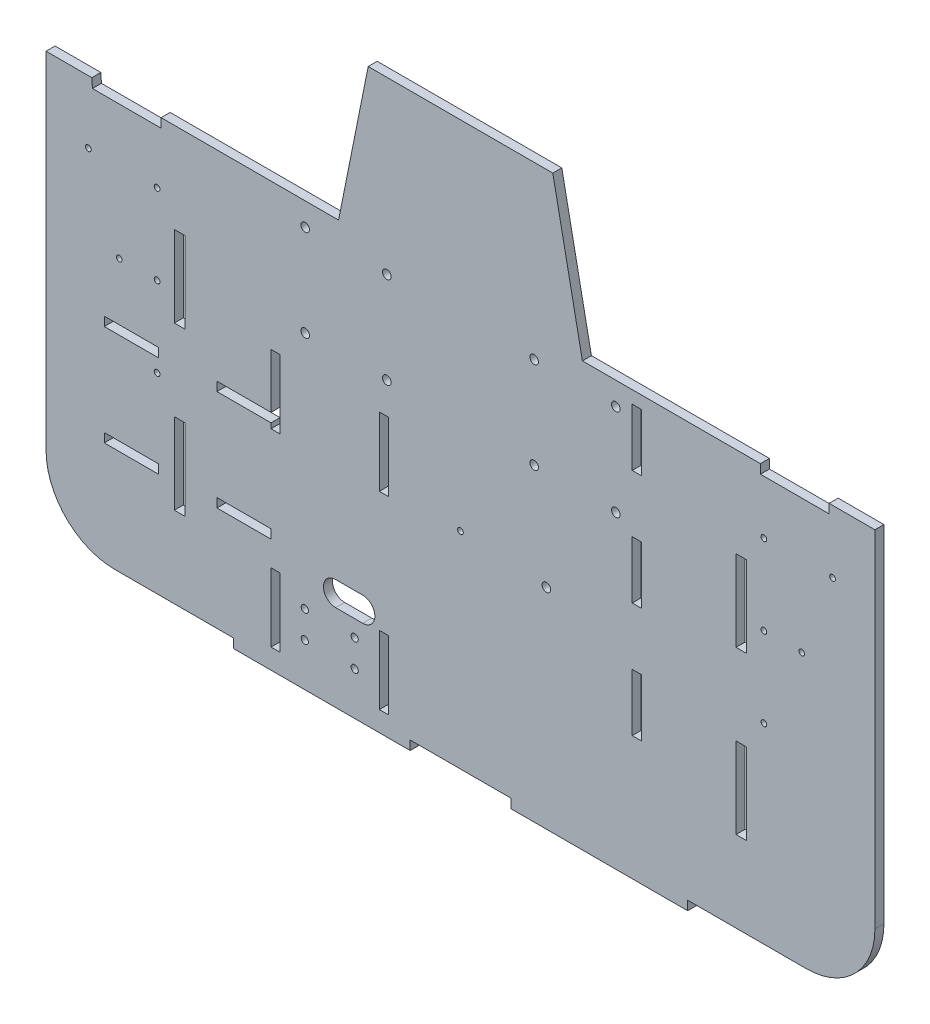
from build123d import *

# Parameters (mm, degrees)
SKETCH2_R           = 3.175
SKETCH2_R_2         = 4.7625
SKETCH2_R_3         = 4
SKETCH2_W           = 11.850089675
SKETCH2_H           = 89.916
SKETCH2_W_2         = 60
SKETCH2_H_2         = 10
SKETCH2_W_3         = 10.16
SKETCH2_H_3         = 63.685061478
SKETCH2_H_4         = 63.685061479
SKETCH2_H_5         = 76.2
BOSS_EXTRUDE1_DEPTH = 10


with BuildPart() as part:
    # Sketch2 → Boss-Extrude1 (new body)
    with BuildSketch(Plane.XY):
        with BuildLine():
            Line((-408.921789204, 152.75736057), (-459.721789204, 152.75736057))
            Line((-459.721789204, 152.75736057), (-459.721789204, -230.782639429))
            ThreePointArc((-459.721789204, -230.782639429), (-437.403325931, -284.664176156), (-383.521789204, -306.982639429))
            Line((-383.521789204, -306.982639429), (-303.52, -306.982639429))
            Line((-303.52, -306.982639429), (-252, -306.982639429))
            Line((-252, -306.982639429), (-252, -317.142639429))
            Line((-252, -317.142639429), (-55.8292, -317.142639429))
            Line((-55.8292, -317.142639429), (-55.8292, -306.982639429))
            Line((-55.8292, -306.982639429), (55.8292, -306.982639429))
            Line((55.8292, -306.982639429), (55.8292, -317.142639429))
            Line((55.8292, -317.142639429), (252, -317.142639429))
            Line((252, -317.142639429), (252, -306.982639429))
            Line((252, -306.982639429), (303.52, -306.982639429))
            Line((303.52, -306.982639429), (383.521789204, -306.982639429))
            ThreePointArc((383.521789204, -306.982639429), (437.403325931, -284.664176156), (459.721789204, -230.782639429))
            Line((459.721789204, -230.782639429), (459.721789204, 152.75736057))
            Line((459.721789204, 152.75736057), (408.921789204, 152.75736057))
            Line((408.921789204, 152.75736057), (408.921789204, 142.616356263))
            Line((408.921789204, 142.616356263), (332.721789204, 142.616356263))
            Line((332.721789204, 142.616356263), (332.721789204, 152.75736057))
            Line((332.721789204, 152.75736057), (135.250547773, 152.75736057))
            Line((135.250547773, 152.75736057), (102.394461083, 316.728644457))
            Line((102.394461083, 316.728644457), (-102.394461083, 316.728644457))
            Line((-102.394461083, 316.728644457), (-135.250547773, 152.75736057))
            Line((-135.250547773, 152.75736057), (-332.100796745, 152.75736057))
            Line((-332.100796745, 152.75736057), (-332.100796745, 142.616356263))
            Line((-332.100796745, 142.616356263), (-408.300796745, 142.616356263))
            Line((-408.300796745, 142.616356263), (-408.921789204, 152.75736057))
        make_face()
        with Locations((336.550272189, -94.687385458)):
            Circle(SKETCH2_R, mode=Mode.SUBTRACT)
        with Locations((378.573819589, -5.78737531)):
            Circle(SKETCH2_R, mode=Mode.SUBTRACT)
        with Locations((336.550272189, -5.787385458)):
            Circle(SKETCH2_R, mode=Mode.SUBTRACT)
        with Locations((336.550272189, 83.112614542)):
            Circle(SKETCH2_R, mode=Mode.SUBTRACT)
        with Locations((412.750272189, 83.112614542)):
            Circle(SKETCH2_R, mode=Mode.SUBTRACT)
        with Locations((-412.75027219, 83.112614542)):
            Circle(SKETCH2_R, mode=Mode.SUBTRACT)
        with Locations((-336.55027219, 83.112614542)):
            Circle(SKETCH2_R, mode=Mode.SUBTRACT)
        with Locations((-336.55027219, -5.787385458)):
            Circle(SKETCH2_R, mode=Mode.SUBTRACT)
        with Locations((-378.573819589, -5.78737531)):
            Circle(SKETCH2_R, mode=Mode.SUBTRACT)
        with Locations((-336.55027219, -94.687385458)):
            Circle(SKETCH2_R, mode=Mode.SUBTRACT)
        with Locations((172.2755, 127.35736057)):
            Circle(SKETCH2_R_2, mode=Mode.SUBTRACT)
        with Locations((172.2755, 25.75736057)):
            Circle(SKETCH2_R_2, mode=Mode.SUBTRACT)
        with Locations((81.7245, 25.75736057)):
            Circle(SKETCH2_R_2, mode=Mode.SUBTRACT)
        with Locations((81.7245, 127.35736057)):
            Circle(SKETCH2_R_2, mode=Mode.SUBTRACT)
        with Locations((-81.7245, 25.75736057)):
            Circle(SKETCH2_R_2, mode=Mode.SUBTRACT)
        with Locations((-81.7245, 127.35736057)):
            Circle(SKETCH2_R_2, mode=Mode.SUBTRACT)
        with Locations((-172.2755, 127.35736057)):
            Circle(SKETCH2_R_2, mode=Mode.SUBTRACT)
        with Locations((-172.2755, 25.75736057)):
            Circle(SKETCH2_R_2, mode=Mode.SUBTRACT)
        with Locations((0, -78.38263943)):
            Circle(SKETCH2_R, mode=Mode.SUBTRACT)
        with Locations((95.25, -84.73263943)):
            Circle(SKETCH2_R_2, mode=Mode.SUBTRACT)
        with Locations((-172.69, -239.442639429)):
            Circle(SKETCH2_R_3, mode=Mode.SUBTRACT)
        with Locations((-117.38, -239.442639429)):
            Circle(SKETCH2_R_3, mode=Mode.SUBTRACT)
        with Locations((-117.38, -269.442639429)):
            Circle(SKETCH2_R_3, mode=Mode.SUBTRACT)
        with Locations((-172.69, -269.442639429)):
            Circle(SKETCH2_R_3, mode=Mode.SUBTRACT)
        with Locations((311.557332494, 7.72336057)):
            Rectangle(SKETCH2_W, SKETCH2_H, mode=Mode.SUBTRACT)
        with Locations((311.557332494, -172.10863943)):
            Rectangle(SKETCH2_W, SKETCH2_H, mode=Mode.SUBTRACT)
        with Locations((-365.16, -74.446988355)):
            Rectangle(SKETCH2_W_2, SKETCH2_H_2, mode=Mode.SUBTRACT)
        Polygon((-270.16, -79.446988355), (-210.16, -79.446988355), (-210.16, -85.16237531), (-200, -85.16237531), (-200, -8.96237531), (-210.16, -8.96237531), (-210.16, -69.446988355), (-270.16, -69.446988355), align=None, mode=Mode.SUBTRACT)
        with Locations((195.58, -147.752560311)):
            Rectangle(SKETCH2_W_3, SKETCH2_H_3, mode=Mode.SUBTRACT)
        with Locations((195.58, -20.382437355)):
            Rectangle(SKETCH2_W_3, SKETCH2_H_4, mode=Mode.SUBTRACT)
        with Locations((195.58, 106.97026018)):
            Rectangle(SKETCH2_W_3, SKETCH2_H_4, mode=Mode.SUBTRACT)
        with Locations((-205.08, -256.782661115)):
            Rectangle(SKETCH2_W_3, SKETCH2_H_5, mode=Mode.SUBTRACT)
        with Locations((-240.16, -186.254154613)):
            Rectangle(SKETCH2_W_2, SKETCH2_H_2, mode=Mode.SUBTRACT)
        with Locations((-365.16, -186.254154613)):
            Rectangle(SKETCH2_W_2, SKETCH2_H_2, mode=Mode.SUBTRACT)
        with Locations((-311.557332494, -172.10863943)):
            Rectangle(SKETCH2_W, SKETCH2_H, mode=Mode.SUBTRACT)
        with Locations((-84.92, -256.782661115)):
            Rectangle(SKETCH2_W_3, SKETCH2_H_5, mode=Mode.SUBTRACT)
        with Locations((-84.92, -47.06237531)):
            Rectangle(SKETCH2_W_3, SKETCH2_H_5, mode=Mode.SUBTRACT)
        with Locations((-311.557332494, 7.72336057)):
            Rectangle(SKETCH2_W, SKETCH2_H, mode=Mode.SUBTRACT)
        with BuildLine():
            Line((-108.5, -221.170881029), (-138.5, -221.170881029))
            ThreePointArc((-138.5, -221.170881029), (-152, -207.670881029), (-138.5, -194.170881029))
            Line((-138.5, -194.170881029), (-108.5, -194.170881029))
            ThreePointArc((-108.5, -194.170881029), (-95, -207.670881029), (-108.5, -221.170881029))
        make_face(mode=Mode.SUBTRACT)
    extrude(amount=-BOSS_EXTRUDE1_DEPTH)


solid = part.part
